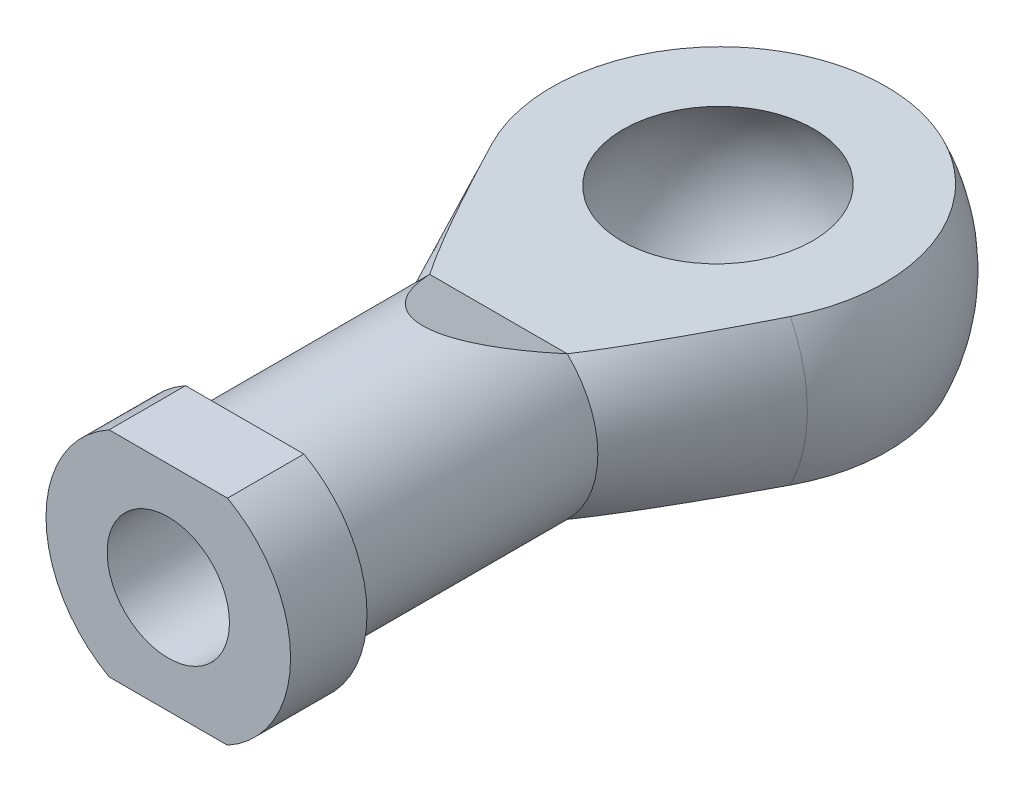
from build123d import *

# Parameters (mm, degrees)
WYTNIJ_WYCI_GNI_CIE4_DEPTH      = 51.911688245
WYTNIJ_WYCI_GNI_CIE4_DEPTH_BACK = 51.911688245
SZKIC3_R                        = 4
WYTNIJ_WYCI_GNI_CIE5_DEPTH      = 16


with BuildPart() as part:
    # Szkic1 → Obrót2 (revolve)
    with BuildSketch(Plane(origin=(0, 0, 0), x_dir=(1, 0, 0), z_dir=(0, 1, 0))):
        with BuildLine():
            Line((-6.5, 21.6), (-10.875693419, 30.928580805))
            ThreePointArc((-10.875693419, 30.928580805), (-10.120697366, 42.447595275), (0, 48))
            Line((0, 48), (0, 43.9))
            ThreePointArc((0, 43.9), (-7.9, 36), (0, 28.1))
            Line((0, 28.1), (0, 0))
            Line((0, 0), (-8, 0))
            Line((-8, 0), (-8, 5))
            Line((-8, 5), (-6.5, 5))
            Line((-6.5, 5), (-6.5, 21.6))
        make_face()
    revolve(axis=Axis((0, 0, 0), (0, 0, -1)))

    # Szkic2 → Wytnij-wyciągnięcie4 (cut, two sides: drawn at the far end of the back side and taken through both)
    with BuildSketch(Plane(origin=(0, 0, 0), x_dir=(0, 0, -1), z_dir=(1, 0, 0)).offset(-WYTNIJ_WYCI_GNI_CIE4_DEPTH_BACK)):
        Polygon((-3.907028002, 7), (15.285299148, 7), (21.6, 4.692235368), (53.373745371, 4.974753225), (53.373745371, 17.177829275), (-3.907028002, 17.177829275), align=None)
        Polygon((-3.907028002, -17.177829275), (-3.907028002, -7), (15.285299148, -7), (21.6, -4.692235368), (53.373745371, -4.974753225), (53.373745371, -17.177829275), align=None)
    extrude(amount=WYTNIJ_WYCI_GNI_CIE4_DEPTH + WYTNIJ_WYCI_GNI_CIE4_DEPTH_BACK, mode=Mode.SUBTRACT)

    # Szkic3 → Wytnij-wyciągnięcie5 (cut)
    with BuildSketch(Plane.XY):
        Circle(SZKIC3_R)
    extrude(amount=-WYTNIJ_WYCI_GNI_CIE5_DEPTH, mode=Mode.SUBTRACT)


solid = part.part
